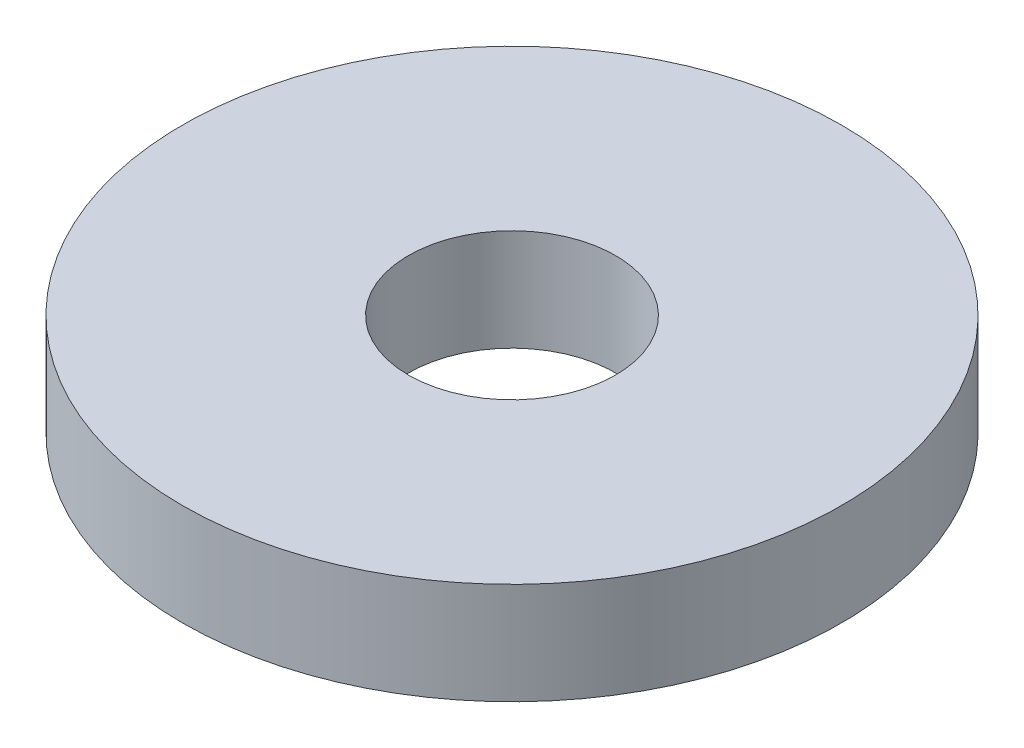
from build123d import *

# Parameters (mm, degrees)
SKETCH1_R           = 87.5
BOSS_EXTRUDE1_DEPTH = 27
SKETCH2_R           = 27.5
CUT_EXTRUDE1_DEPTH  = 127.655043326


with BuildPart() as part:
    # Sketch1 → Boss-Extrude1 (new body)
    with BuildSketch(Plane(origin=(0, 0, 0), x_dir=(1, 0, 0), z_dir=(0, 1, 0))):
        Circle(SKETCH1_R)
    extrude(amount=BOSS_EXTRUDE1_DEPTH)

    # Sketch2 → Cut-Extrude1 (cut, through all)
    with BuildSketch(Plane(origin=(0, 0, 0), x_dir=(1, 0, 0), z_dir=(0, 1, 0))):
        Circle(SKETCH2_R)
    extrude(amount=CUT_EXTRUDE1_DEPTH, mode=Mode.SUBTRACT)


solid = part.part
